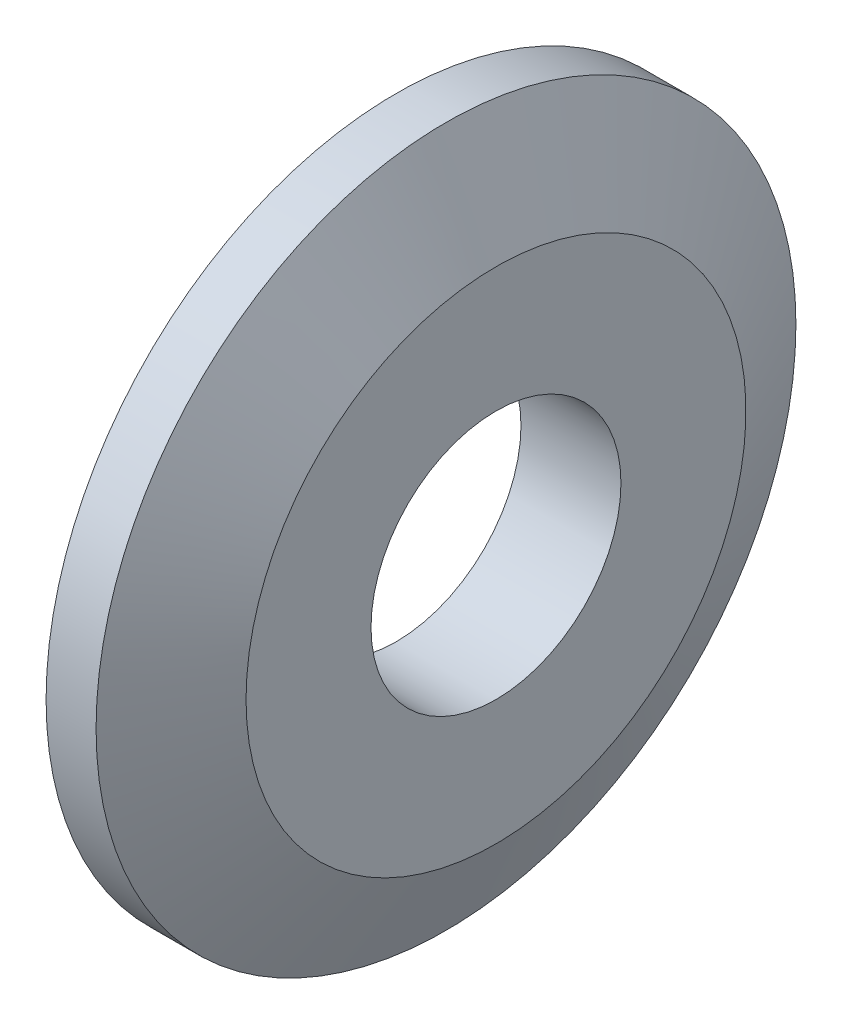
from build123d import *


with BuildPart() as part:
    # Esquisse1 → Révolution1 (revolve)
    with BuildSketch(Plane.XY):
        Polygon((0, 2.5), (0, 7), (1, 7), (2, 5), (2, 2.5), align=None)
    revolve(axis=Axis((0, 0, 0), (1, 0, 0)))


solid = part.part
